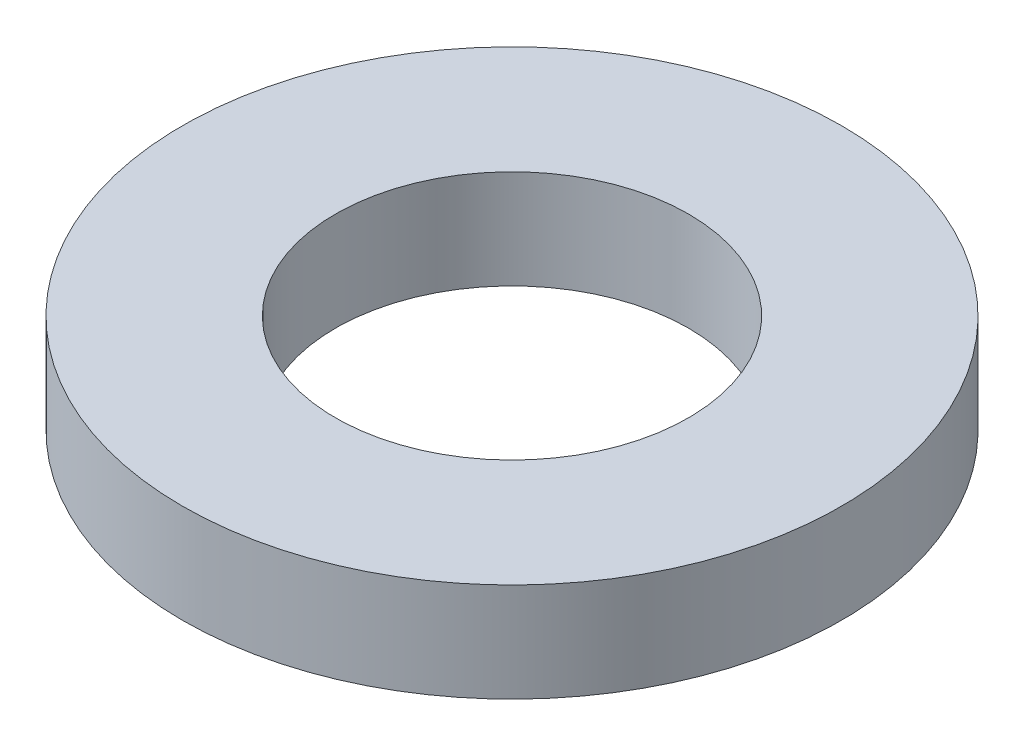
from build123d import *

# Parameters (mm, degrees)
SKETCH1_R           = 70
BOSS_EXTRUDE1_DEPTH = 21
SKETCH2_R           = 37.5
CUT_EXTRUDE1_DEPTH  = 102.197826064


with BuildPart() as part:
    # Sketch1 → Boss-Extrude1 (new body)
    with BuildSketch(Plane(origin=(0, 0, 0), x_dir=(1, 0, 0), z_dir=(0, 1, 0))):
        Circle(SKETCH1_R)
    extrude(amount=BOSS_EXTRUDE1_DEPTH)

    # Sketch2 → Cut-Extrude1 (cut, through all)
    with BuildSketch(Plane(origin=(0, 0, 0), x_dir=(1, 0, 0), z_dir=(0, 1, 0))):
        Circle(SKETCH2_R)
    extrude(amount=CUT_EXTRUDE1_DEPTH, mode=Mode.SUBTRACT)


solid = part.part
